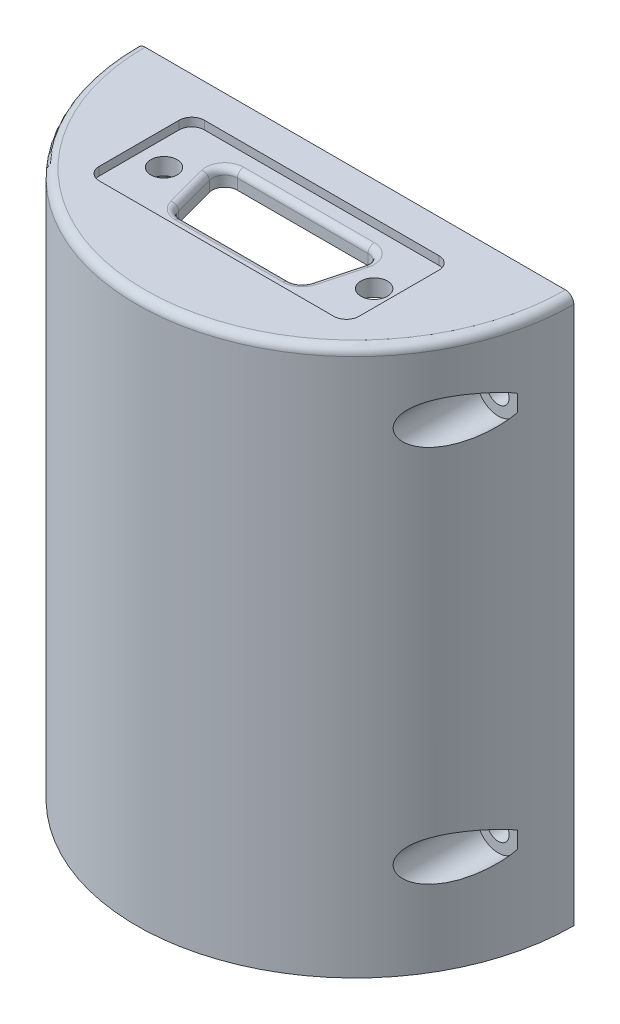
from build123d import *

# Parameters (mm, degrees)
EXTRUDE_1_DEPTH       = 65
EXTRUDE_5_REACH       = 76.679
SKETCH_12_R           = 3
SKETCH_16_R           = 1.3
CUT_EXTRUDE_2_DEPTH   = 75.679314492
EXTRUDE_START         = -3
EXTRUDE_6_DEPTH       = 3
FILLET_1_R            = 1
CUT_EXTRUDE_START     = -6
SKETCH_16_4_R         = 2.5
CUT_EXTRUDE_4_DEPTH   = 69.679314475
SKETCH_24_W           = 30.9
SKETCH_24_H           = 12.5
CUT_EXTRUDE_8_DEPTH   = 1
CUT_EXTRUDE_9_REACH   = 75.811
FILLET_2_R            = 1.5
FILLET_3_R            = 0.75
HOLE_WIZARD_M31_D     = 3.15
HOLE_WIZARD_M31_DEPTH = 10
HOLE_WIZARD_M31_TIP   = 0.946355475


with BuildPart() as part:
    # Эскиз1 → Бобышка-Вытянуть1 (new body)
    with BuildSketch(Plane(origin=(0, 0, 0), x_dir=(1, 0, 0), z_dir=(0, 1, 0))):
        with BuildLine():
            Line((-26, 0), (-23, 0))
            ThreePointArc((-23, 0), (0, -23), (23, 0))
            Line((23, 0), (26, 0))
            ThreePointArc((26, 0), (0, -26), (-26, 0))
        make_face()
    extrude(amount=EXTRUDE_1_DEPTH)

    # Эскиз12 → Бобышка-Вытянуть5 (add, up to next)
    with BuildSketch(Plane(origin=(0, 0, 0), x_dir=(-1, 0, 0), z_dir=(0, 0, -1)), mode=Mode.PRIVATE) as extrude_5_sk1:
        with Locations((23, 56.5)):
            Circle(SKETCH_12_R)
    extrude_5_tool1 = extrude(extrude_5_sk1.sketch, amount=-EXTRUDE_5_REACH, mode=Mode.PRIVATE) - part.part
    # Эскиз12 → Бобышка-Вытянуть5 (add, up to next)
    with BuildSketch(Plane(origin=(0, 0, 0), x_dir=(-1, 0, 0), z_dir=(0, 0, -1)), mode=Mode.PRIVATE) as extrude_5_sk2:
        with Locations((23, 11.5)):
            Circle(SKETCH_12_R)
    extrude_5_tool2 = extrude(extrude_5_sk2.sketch, amount=-EXTRUDE_5_REACH, mode=Mode.PRIVATE) - part.part
    # Эскиз12 → Бобышка-Вытянуть5 (add, up to next)
    with BuildSketch(Plane(origin=(0, 0, 0), x_dir=(-1, 0, 0), z_dir=(0, 0, -1)), mode=Mode.PRIVATE) as extrude_5_sk3:
        with Locations((-23, 56.5)):
            Circle(SKETCH_12_R)
    extrude_5_tool3 = extrude(extrude_5_sk3.sketch, amount=-EXTRUDE_5_REACH, mode=Mode.PRIVATE) - part.part
    # Эскиз12 → Бобышка-Вытянуть5 (add, up to next)
    with BuildSketch(Plane(origin=(0, 0, 0), x_dir=(-1, 0, 0), z_dir=(0, 0, -1)), mode=Mode.PRIVATE) as extrude_5_sk4:
        with Locations((-23, 11.5)):
            Circle(SKETCH_12_R)
    extrude_5_tool4 = extrude(extrude_5_sk4.sketch, amount=-EXTRUDE_5_REACH, mode=Mode.PRIVATE) - part.part
    add(extrude_5_tool1.solids().sort_by_distance((-23, 56.5, 0))[0])
    add(extrude_5_tool2.solids().sort_by_distance((-23, 11.5, 0))[0])
    add(extrude_5_tool3.solids().sort_by_distance((23, 56.5, 0))[0])
    add(extrude_5_tool4.solids().sort_by_distance((23, 11.5, 0))[0])

    # Эскиз16 → Вырез-Вытянуть2 (cut, through all)
    with BuildSketch(Plane(origin=(0, 0, 0), x_dir=(-1, 0, 0), z_dir=(0, 0, -1))):
        with Locations((23, 56.5)):
            Circle(SKETCH_16_R)
        with Locations((23, 11.5)):
            Circle(SKETCH_16_R)
        with Locations((-23, 11.5)):
            Circle(SKETCH_16_R)
        with Locations((-23, 56.5)):
            Circle(SKETCH_16_R)
    extrude(amount=-CUT_EXTRUDE_2_DEPTH, mode=Mode.SUBTRACT)

    # Эскиз2 → Бобышка-Вытянуть6 (add)
    with BuildSketch(Plane(origin=(0, 65, 0), x_dir=(1, 0, 0), z_dir=(0, 1, 0)).offset(EXTRUDE_START)):
        with BuildLine():
            Line((-26, 0), (26, 0))
            ThreePointArc((26, 0), (0, -26), (-26, 0))
        make_face()
    extrude(amount=EXTRUDE_6_DEPTH)

    # Скругление1
    fillet_1_edges = [part.edges().sort_by_distance(p)[0] for p in [
        (0, 65, 26),
    ]]
    fillet(fillet_1_edges, radius=FILLET_1_R)

    # Эскиз16<4> → Вырез-Вытянуть4 (cut, through all)
    with BuildSketch(Plane(origin=(0, 0, 0), x_dir=(-1, 0, 0), z_dir=(0, 0, -1)).offset(CUT_EXTRUDE_START)):
        with Locations((-23, 56.5)):
            Circle(SKETCH_16_4_R)
        with Locations((-23, 11.5)):
            Circle(SKETCH_16_4_R)
        with Locations((23, 11.5)):
            Circle(SKETCH_16_4_R)
        with Locations((23, 56.5)):
            Circle(SKETCH_16_4_R)
    extrude(amount=-CUT_EXTRUDE_4_DEPTH, mode=Mode.SUBTRACT)

    # Эскиз24 → Вырез-Вытянуть8 (cut)
    with BuildSketch(Plane(origin=(0, 65, 0), x_dir=(1, 0, 0), z_dir=(0, 1, 0))):
        with Locations((0, -10.25)):
            Rectangle(SKETCH_24_W, SKETCH_24_H)
    extrude(amount=-CUT_EXTRUDE_8_DEPTH, mode=Mode.SUBTRACT)

    # Эскиз25 → Вырез-Вытянуть9 (cut, up to next)
    with BuildSketch(Plane(origin=(0, 64, 0), x_dir=(1, 0, 0), z_dir=(0, 1, 0)), mode=Mode.PRIVATE) as cut_extrude_9_sk1:
        Polygon((-9.723593539, -6.25), (-7.58, -14.25), (7.58, -14.25), (9.723593539, -6.25), align=None)
    cut_extrude_9_tool1 = extrude(cut_extrude_9_sk1.sketch, amount=-CUT_EXTRUDE_9_REACH, mode=Mode.PRIVATE) & part.part
    add(cut_extrude_9_tool1.solids().sort_by_distance((0, 64, 10.084825))[0], mode=Mode.SUBTRACT)

    # Скругление2
    fillet_2_edges = [part.edges().sort_by_distance(p)[0] for p in [
        (-15.45, 64.5, 16.5),
        (-7.58, 63, 14.25),
        (-9.723593539, 63, 6.25),
        (-15.45, 64.5, 4),
        (9.723593539, 63, 6.25),
        (7.58, 63, 14.25),
        (15.45, 64.5, 16.5),
        (15.45, 64.5, 4),
    ]]
    fillet(fillet_2_edges, radius=FILLET_2_R)

    # Скругление3
    fillet_3_edges = [part.edges().sort_by_distance(p)[0] for p in [
        (-8.958785491, 64, 6.836857856),
        (0, 64, 6.25),
        (8.958785491, 64, 6.836857856),
        (8.547771239, 64, 10.638228568),
        (7.342151662, 64, 13.94003001),
        (0, 64, 14.25),
        (-7.342151662, 64, 13.94003001),
        (-8.547771239, 64, 10.638228568),
    ]]
    fillet(fillet_3_edges, radius=FILLET_3_R)

    # Сверло под метчик  спиральное M31
    with Locations(Plane(origin=(0, 64, 0), x_dir=(1, 0, 0), z_dir=(0, 1, 0))):
        with Locations((-12.5, -10.25), (12.5, -10.25)):
            Hole(HOLE_WIZARD_M31_D / 2, depth=HOLE_WIZARD_M31_DEPTH)
            with Locations((0, 0, -(HOLE_WIZARD_M31_DEPTH + HOLE_WIZARD_M31_TIP / 2))):  # 118° drill point
                Cone(0, HOLE_WIZARD_M31_D / 2, HOLE_WIZARD_M31_TIP, mode=Mode.SUBTRACT)


solid = part.part
